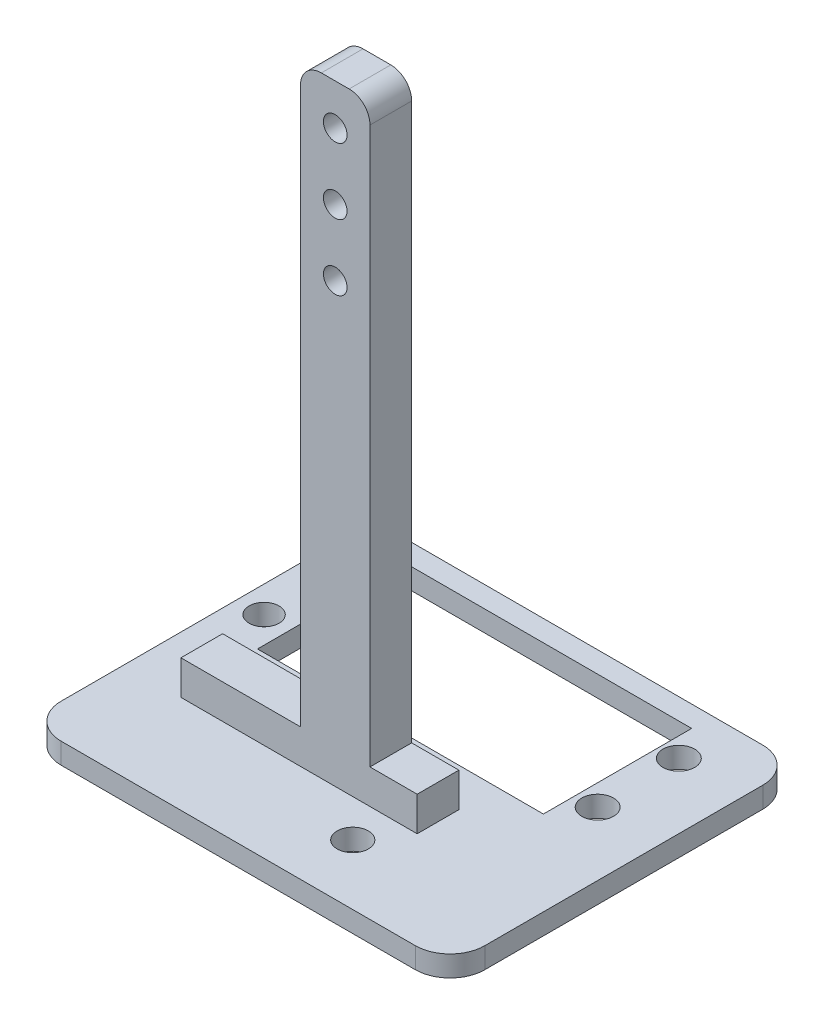
from build123d import *

# Parameters (mm, degrees)
SKETCH1_R           = 1.7
BOSS_EXTRUDE1_DEPTH = 6
SKETCH3_R           = 2.25
SKETCH3_W           = 5
SKETCH3_H           = 6
BOSS_EXTRUDE2_DEPTH = 3
SKETCH4_W           = 41.148
SKETCH4_H           = 21.336
CUT_EXTRUDE1_DEPTH  = 7.62
SKETCH5_R           = 2.286
SKETCH5_R_2         = 2.159
CUT_EXTRUDE2_DEPTH  = 104.499175858


with BuildPart() as part:
    # Sketch1 → Boss-Extrude1 (new body)
    with BuildSketch(Plane.XY):
        with BuildLine():
            Line((-20.300553918, -42.2194826), (-37.507045119, -42.2194826))
            Line((-37.507045119, -42.2194826), (-37.507045119, -47.153670861))
            Line((-37.507045119, -47.153670861), (-30.507045119, -47.153670861))
            Line((-30.507045119, -47.153670861), (-30.507045119, -50.153670861))
            Line((-30.507045119, -50.153670861), (-25.507045119, -50.153670861))
            Line((-25.507045119, -50.153670861), (-25.507045119, -47.153670861))
            Line((-25.507045119, -47.153670861), (-21.507045119, -47.153670861))
            Line((-21.507045119, -47.153670861), (-21.507045119, -50.153670861))
            Line((-21.507045119, -50.153670861), (-16.507045119, -50.153670861))
            Line((-16.507045119, -50.153670861), (-16.507045119, -47.153670861))
            Line((-16.507045119, -47.153670861), (-12.507045119, -47.153670861))
            Line((-12.507045119, -47.153670861), (-12.507045119, -50.153670861))
            Line((-12.507045119, -50.153670861), (-7.507045119, -50.153670861))
            Line((-7.507045119, -50.153670861), (-7.507045119, -47.153670861))
            Line((-7.507045119, -47.153670861), (-3.507045119, -47.153670861))
            Line((-3.507045119, -47.153670861), (-3.507045119, -42.2194826))
            Line((-3.507045119, -42.2194826), (-10.300553918, -42.2194826))
            Line((-10.300553918, -42.2194826), (-10.300553918, 37.7805174))
            ThreePointArc((-10.300553918, 37.7805174), (-11.179233574, 39.901837744), (-13.300553918, 40.7805174))
            Line((-13.300553918, 40.7805174), (-17.300553918, 40.7805174))
            ThreePointArc((-17.300553918, 40.7805174), (-19.421874261, 39.901837744), (-20.300553918, 37.7805174))
            Line((-20.300553918, 37.7805174), (-20.300553918, -42.2194826))
        make_face()
        with Locations((-15.300553918, 25.3805174)):
            Circle(SKETCH1_R, mode=Mode.SUBTRACT)
        with Locations((-15.300553918, 15.8805174)):
            Circle(SKETCH1_R, mode=Mode.SUBTRACT)
        with Locations((-15.300553918, 34.8805174)):
            Circle(SKETCH1_R, mode=Mode.SUBTRACT)
    extrude(amount=BOSS_EXTRUDE1_DEPTH)


with BuildPart() as body_2:
    # Sketch3 → Boss-Extrude2 (new body)
    with BuildSketch(Plane.XZ.offset(47.153670861)):
        with BuildLine():
            Line((10.305910507, -29.922601001), (-40.654089493, -29.922601001))
            ThreePointArc((-40.654089493, -29.922601001), (-44.189623399, -28.458134907), (-45.654089493, -24.922601001))
            Line((-45.654089493, -24.922601001), (-45.654089493, 15.077398999))
            ThreePointArc((-45.654089493, 15.077398999), (-44.189623399, 18.612932905), (-40.654089493, 20.077398999))
            Line((-40.654089493, 20.077398999), (10.305910507, 20.077398999))
            ThreePointArc((10.305910507, 20.077398999), (13.841444413, 18.612932905), (15.305910507, 15.077398999))
            Line((15.305910507, 15.077398999), (15.305910507, -24.922601001))
            ThreePointArc((15.305910507, -24.922601001), (13.841444413, -28.458134907), (10.305910507, -29.922601001))
        make_face()
        with Locations((-7.375088669, 11.4)):
            Circle(SKETCH3_R, mode=Mode.SUBTRACT)
        with Locations((-28.007045119, 3)):
            Rectangle(SKETCH3_W, SKETCH3_H, mode=Mode.SUBTRACT)
        with Locations((-19.007045119, 3)):
            Rectangle(SKETCH3_W, SKETCH3_H, mode=Mode.SUBTRACT)
        with Locations((-10.007045119, 3)):
            Rectangle(SKETCH3_W, SKETCH3_H, mode=Mode.SUBTRACT)
    extrude(amount=BOSS_EXTRUDE2_DEPTH)

    # Sketch4 → Cut-Extrude1 (cut)
    with BuildSketch(Plane(origin=(0, -47.153670861, 0), x_dir=(1, 0, 0), z_dir=(0, 1, 0))):
        with Locations((-17.460089493, 16.214343835)):
            Rectangle(SKETCH4_W, SKETCH4_H)
    extrude(amount=-CUT_EXTRUDE1_DEPTH, mode=Mode.SUBTRACT)

    # Sketch5 → Cut-Extrude2 (cut, through all)
    with BuildSketch(Plane(origin=(0, -47.153670861, 0), x_dir=(1, 0, 0), z_dir=(0, 1, 0))):
        with Locations((-41.844089493, 22.24256147)):
            Circle(SKETCH5_R)
        with Locations((-41.844089493, 10.30456147)):
            Circle(SKETCH5_R_2)
        with Locations((5.907910507, 22.24256147)):
            Circle(SKETCH5_R)
        with Locations((6.161910507, 10.30456147)):
            Circle(SKETCH5_R)
    extrude(amount=-CUT_EXTRUDE2_DEPTH, mode=Mode.SUBTRACT)


solid = Compound([part.part, body_2.part])
